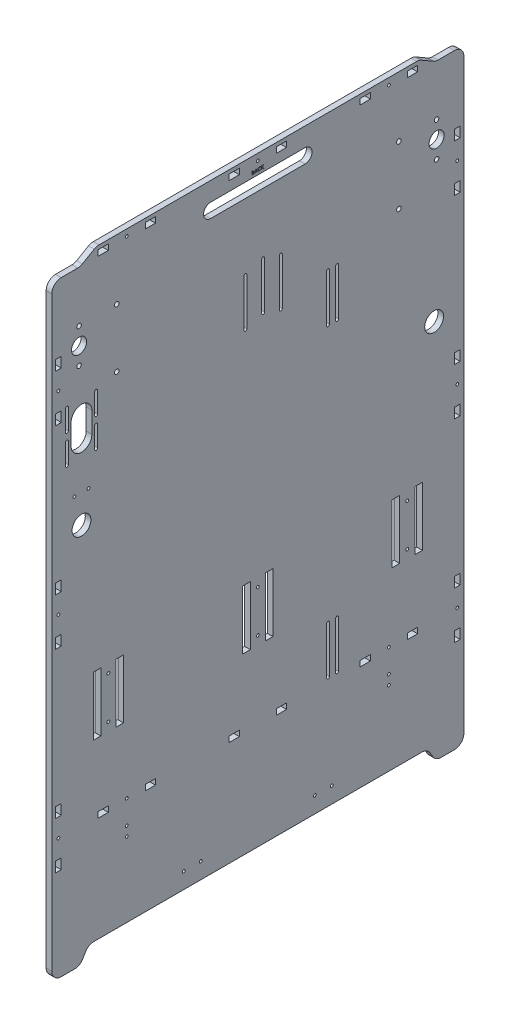
from build123d import *
from build123d.topology import SkipClean

# Parameters (mm, degrees)
SKETCH1_R             = 1.5
SKETCH1_W             = 10.8
SKETCH1_H             = 6
SKETCH1_H_2           = 7
SKETCH1_W_2           = 6
SKETCH1_H_3           = 10.8
BOSS_EXTRUDE1_DEPTH   = 6
SKETCH2_R             = 8
SKETCH2_R_2           = 2.425
CUT_EXTRUDE1_DEPTH    = 688.648458516
FILLET2_R             = 10
FILLET2_OF_MIRROR1_R  = 10
CUT_EXTRUDE2_DEPTH    = 688.648458516
SKETCH4_R             = 2.425
SKETCH4_R_2           = 1.5
SKETCH4_W             = 8
SKETCH4_H             = 62.5
CUT_EXTRUDE3_DEPTH    = 688.648458516
SKETCH5_R             = 1.5
CUT_EXTRUDE6_DEPTH    = 688.648458516
DELETEFACE2_START     = -169.366666667
DELETEFACE2_OUTLINE_W = 6
DELETEFACE2_OUTLINE_H = 7
DELETEFACE2_DEPTH     = 338.733333334
SKETCH7_R             = 1.5
CUT_EXTRUDE7_DEPTH    = 688.648458516
DELETEFACE3_OUTLINE_R = 1.5
DELETEFACE3_DEPTH     = 6
CUT_EXTRUDE8_DEPTH    = 688.648458516
SKETCH9_R             = 10
CUT_EXTRUDE9_DEPTH    = 688.648458516
SKETCH10_R            = 1.5
CUT_EXTRUDE10_DEPTH   = 688.648458516
CUT_EXTRUDE11_DEPTH   = 688.648458516
CUT_EXTRUDE12_DEPTH   = 0.5


# Read off the part's stored shape, not the designer's step: DeleteFace2, DeleteFace3
with BuildPart() as part:
    # Sketch1 → Boss-Extrude1 (new body)
    with BuildSketch(Plane(origin=(0, 0, 0), x_dir=(0, 0, -1), z_dir=(1, 0, 0))):
        with BuildLine():
            Line((0, 652), (-171.129491924, 652))
            Line((-171.129491924, 652), (-188.45, 642))
            Line((-188.45, 642), (-218.45, 642))
            Line((-218.45, 642), (-218.45, 0))
            Line((-218.45, 0), (-188.45, 0))
            Line((-188.45, 0), (-179.789745962, 15))
            Line((-179.789745962, 15), (0, 15))
            Line((0, 15), (0, 127.5))
            ThreePointArc((0, 127.5), (-1.5, 129), (0, 130.5))
            Line((0, 130.5), (0, 643.5))
            ThreePointArc((0, 643.5), (-1.5, 645), (0, 646.5))
            Line((0, 646.5), (0, 652))
        make_face()
        with Locations((-211.45, 539.333333333)):
            Circle(SKETCH1_R, mode=Mode.SUBTRACT)
        with Locations((-211.45, 334)):
            Circle(SKETCH1_R, mode=Mode.SUBTRACT)
        with Locations((-211.45, 128.666666667)):
            Circle(SKETCH1_R, mode=Mode.SUBTRACT)
        with Locations((-138.966666667, 129)):
            Circle(SKETCH1_R, mode=Mode.SUBTRACT)
        with Locations((-138.966666667, 645)):
            Circle(SKETCH1_R, mode=Mode.SUBTRACT)
        with Locations((-113.966666667, 645)):
            Rectangle(SKETCH1_W, SKETCH1_H, mode=Mode.SUBTRACT)
        with Locations((-113.966666667, 129)):
            Rectangle(SKETCH1_W, SKETCH1_H, mode=Mode.SUBTRACT)
        with Locations((-113.966666667, 22.5)):
            Rectangle(SKETCH1_W, SKETCH1_H_2, mode=Mode.SUBTRACT)
        with Locations((-211.45, 564.333333333)):
            Rectangle(SKETCH1_W_2, SKETCH1_H_3, mode=Mode.SUBTRACT)
        with Locations((-211.45, 514.333333333)):
            Rectangle(SKETCH1_W_2, SKETCH1_H_3, mode=Mode.SUBTRACT)
        with Locations((-211.45, 359)):
            Rectangle(SKETCH1_W_2, SKETCH1_H_3, mode=Mode.SUBTRACT)
        with Locations((-211.45, 309)):
            Rectangle(SKETCH1_W_2, SKETCH1_H_3, mode=Mode.SUBTRACT)
        with Locations((-211.45, 153.666666667)):
            Rectangle(SKETCH1_W_2, SKETCH1_H_3, mode=Mode.SUBTRACT)
        with Locations((-211.45, 103.666666667)):
            Rectangle(SKETCH1_W_2, SKETCH1_H_3, mode=Mode.SUBTRACT)
        with Locations((-163.966666667, 129)):
            Rectangle(SKETCH1_W, SKETCH1_H, mode=Mode.SUBTRACT)
        with Locations((-25, 645)):
            Rectangle(SKETCH1_W, SKETCH1_H, mode=Mode.SUBTRACT)
        with Locations((-25, 129)):
            Rectangle(SKETCH1_W, SKETCH1_H, mode=Mode.SUBTRACT)
        with Locations((-163.966666667, 22.5)):
            Rectangle(SKETCH1_W, SKETCH1_H_2, mode=Mode.SUBTRACT)
        with Locations((-25, 22.5)):
            Rectangle(SKETCH1_W, SKETCH1_H_2, mode=Mode.SUBTRACT)
        with Locations((-163.966666667, 645)):
            Rectangle(SKETCH1_W, SKETCH1_H, mode=Mode.SUBTRACT)
    boss_extrude1 = extrude(amount=BOSS_EXTRUDE1_DEPTH)

    # Sketch2 → Cut-Extrude1 (cut, through all)
    with BuildSketch(Plane(origin=(6, 0, 0), x_dir=(0, 0, -1), z_dir=(1, 0, 0))):
        with Locations((-189.55, 569.8)):
            Circle(SKETCH2_R)
        with Locations((-189.55, 588.05)):
            Circle(SKETCH2_R_2)
        with Locations((-189.55, 551.55)):
            Circle(SKETCH2_R_2)
    cut_extrude1 = extrude(amount=-CUT_EXTRUDE1_DEPTH, mode=Mode.SUBTRACT)

    # Fillet2
    fillet2_edges = [part.edges().sort_by_distance(p)[0] for p in [
        (3, 15, 179.789745962),
        (3, 0, 188.45),
        (3, 0, 218.45),
        (3, 642, 218.45),
        (3, 642, 188.45),
        (3, 652, 171.129491924),
    ]]
    fillet(fillet2_edges, radius=FILLET2_R)

    # Mirror1: Boss-Extrude1, Cut-Extrude1 across plane
    with SkipClean():  # the faces are left unmerged after this step: merging them gives an invalid solid
        add(boss_extrude1.mirror(Plane(origin=(6, 130.5, 0), x_dir=(1, 0, 0), z_dir=(0, 0, 1))))
        add(cut_extrude1.mirror(Plane(origin=(6, 130.5, 0), x_dir=(1, 0, 0), z_dir=(0, 0, 1))), mode=Mode.SUBTRACT)

    # Fillet2 of Mirror1
    fillet2_of_mirror1_edges = [part.edges().sort_by_distance(p)[0] for p in [
        (3, 15, -179.789745962),
        (3, 0, -188.45),
        (3, 0, -218.45),
        (3, 642, -218.45),
        (3, 642, -188.45),
        (3, 652, -171.129491924),
    ]]
    fillet(fillet2_of_mirror1_edges, radius=FILLET2_OF_MIRROR1_R)

    # Sketch3 → Cut-Extrude2 (cut, through all)
    with BuildSketch(Plane(origin=(6, 0, 0), x_dir=(0, 0, -1), z_dir=(1, 0, 0))):
        with BuildLine():
            Line((-50, 632), (50, 632))
            ThreePointArc((50, 632), (57.5, 624.5), (50, 617))
            Line((50, 617), (-50, 617))
            ThreePointArc((-50, 617), (-57.5, 624.5), (-50, 632))
        make_face()
    extrude(amount=-CUT_EXTRUDE2_DEPTH, mode=Mode.SUBTRACT)

    # Sketch4 → Cut-Extrude3 (cut, through all)
    with BuildSketch(Plane(origin=(6, 0, 0), x_dir=(0, 0, -1), z_dir=(1, 0, 0))):
        with Locations((-149.55, 588.05)):
            Circle(SKETCH4_R)
        with Locations((-149.55, 526.05)):
            Circle(SKETCH4_R)
        with Locations((-158.45, 253.583333333)):
            Circle(SKETCH4_R_2)
        with Locations((-158.45, 209.083333333)):
            Circle(SKETCH4_R_2)
        with Locations((0, 253.583333333)):
            Circle(SKETCH4_R_2)
        with Locations((0, 209.083333333)):
            Circle(SKETCH4_R_2)
        with Locations((-170.45, 231.333333333)):
            Rectangle(SKETCH4_W, SKETCH4_H)
        with Locations((-146.45, 231.333333333)):
            Rectangle(SKETCH4_W, SKETCH4_H)
        with Locations((-12, 231.333333333)):
            Rectangle(SKETCH4_W, SKETCH4_H)
        with Locations((12, 231.333333333)):
            Rectangle(SKETCH4_W, SKETCH4_H)
    cut_extrude3 = extrude(amount=-CUT_EXTRUDE3_DEPTH, mode=Mode.SUBTRACT)

    # Mirror2: Cut-Extrude3 across plane
    add(cut_extrude3.mirror(Plane.XY), mode=Mode.SUBTRACT)

    # Sketch5 → Cut-Extrude6 (cut, through all)
    with BuildSketch(Plane(origin=(6, 0, 0), x_dir=(0, 0, -1), z_dir=(1, 0, 0))):
        with Locations((-78.483333333, 32)):
            Circle(SKETCH5_R)
        with Locations((-60.483333333, 32)):
            Circle(SKETCH5_R)
    cut_extrude6 = extrude(amount=-CUT_EXTRUDE6_DEPTH, mode=Mode.SUBTRACT)

    # Mirror3: Cut-Extrude6 across plane
    add(cut_extrude6.mirror(Plane.XY), mode=Mode.SUBTRACT)

    # DeleteFace2 outline → DeleteFace2 (add)
    with BuildSketch(Plane.XY.offset(DELETEFACE2_START)):
        with Locations((3, 22.5)):
            Rectangle(DELETEFACE2_OUTLINE_W, DELETEFACE2_OUTLINE_H)
    extrude(amount=DELETEFACE2_DEPTH)

    # Sketch7 → Cut-Extrude7 (cut, through all)
    with BuildSketch(Plane(origin=(6, 0, 0), x_dir=(0, 0, -1), z_dir=(1, 0, 0))):
        with Locations((-194.45, 433.843908623)):
            Circle(SKETCH7_R)
        with Locations((-179.45, 433.843908623)):
            Circle(SKETCH7_R)
        with BuildLine():
            Line((-200.95, 519.343908623), (-200.95, 497.343908623))
            ThreePointArc((-200.95, 497.343908623), (-202.45, 495.843908623), (-203.95, 497.343908623))
            Line((-203.95, 497.343908623), (-203.95, 519.343908623))
            ThreePointArc((-203.95, 519.343908623), (-202.45, 520.843908623), (-200.95, 519.343908623))
        make_face()
        with BuildLine():
            Line((-169.95, 519.343908623), (-169.95, 497.343908623))
            ThreePointArc((-169.95, 497.343908623), (-171.45, 495.843908623), (-172.95, 497.343908623))
            Line((-172.95, 497.343908623), (-172.95, 519.343908623))
            ThreePointArc((-172.95, 519.343908623), (-171.45, 520.843908623), (-169.95, 519.343908623))
        make_face()
        with BuildLine():
            Line((-169.95, 488.343908623), (-169.95, 466.343908623))
            ThreePointArc((-169.95, 466.343908623), (-171.45, 464.843908623), (-172.95, 466.343908623))
            Line((-172.95, 466.343908623), (-172.95, 488.343908623))
            ThreePointArc((-172.95, 488.343908623), (-171.45, 489.843908623), (-169.95, 488.343908623))
        make_face()
        with BuildLine():
            Line((-200.95, 488.343908623), (-200.95, 466.343908623))
            ThreePointArc((-200.95, 466.343908623), (-202.45, 464.843908623), (-203.95, 466.343908623))
            Line((-203.95, 466.343908623), (-203.95, 488.343908623))
            ThreePointArc((-203.95, 488.343908623), (-202.45, 489.843908623), (-200.95, 488.343908623))
        make_face()
        with BuildLine():
            Line((-197.95, 481.843908623), (-197.95, 503.843908623))
            ThreePointArc((-197.95, 503.843908623), (-186.95, 514.843908623), (-175.95, 503.843908623))
            Line((-175.95, 503.843908623), (-175.95, 481.843908623))
            ThreePointArc((-175.95, 481.843908623), (-186.95, 470.843908623), (-197.95, 481.843908623))
        make_face()
    extrude(amount=-CUT_EXTRUDE7_DEPTH, mode=Mode.SUBTRACT)

    # DeleteFace3 outline → DeleteFace3 (add)
    with BuildSketch(Plane.YZ):
        with Locations((129, 0)):
            Circle(DELETEFACE3_OUTLINE_R)
    extrude(amount=DELETEFACE3_DEPTH)

    # Sketch8 → Cut-Extrude8 (cut, through all)
    with BuildSketch(Plane(origin=(6, 0, 0), x_dir=(0, 0, -1), z_dir=(1, 0, 0))):
        with BuildLine():
            Line((72.925, 133.5), (72.925, 183.5))
            ThreePointArc((72.925, 183.5), (74.425, 185), (75.925, 183.5))
            Line((75.925, 183.5), (75.925, 133.5))
            ThreePointArc((75.925, 133.5), (74.425, 132), (72.925, 133.5))
        make_face()
        with BuildLine():
            Line((82.525, 133.5), (82.525, 183.5))
            ThreePointArc((82.525, 183.5), (84.025, 185), (85.525, 183.5))
            Line((85.525, 183.5), (85.525, 133.5))
            ThreePointArc((85.525, 133.5), (84.025, 132), (82.525, 133.5))
        make_face()
        with BuildLine():
            Line((72.925, 457), (72.925, 507))
            ThreePointArc((72.925, 507), (74.425, 508.5), (75.925, 507))
            Line((75.925, 507), (75.925, 457))
            ThreePointArc((75.925, 457), (74.425, 455.5), (72.925, 457))
        make_face()
        with BuildLine():
            Line((82.525, 457), (82.525, 507))
            ThreePointArc((82.525, 507), (84.025, 508.5), (85.525, 507))
            Line((85.525, 507), (85.525, 457))
            ThreePointArc((85.525, 457), (84.025, 455.5), (82.525, 457))
        make_face()
    extrude(amount=-CUT_EXTRUDE8_DEPTH, mode=Mode.SUBTRACT)

    # Sketch9 → Cut-Extrude9 (cut, through all)
    with BuildSketch(Plane(origin=(6, 0, 0), x_dir=(0, 0, -1), z_dir=(1, 0, 0))):
        with Locations((-186.95, 403.843908623)):
            Circle(SKETCH9_R)
    cut_extrude9 = extrude(amount=-CUT_EXTRUDE9_DEPTH, mode=Mode.SUBTRACT)

    # Mirror4: Cut-Extrude9 across plane
    add(cut_extrude9.mirror(Plane.XY), mode=Mode.SUBTRACT)

    # Sketch10 → Cut-Extrude10 (cut, through all)
    with BuildSketch(Plane(origin=(6, 0, 0), x_dir=(0, 0, -1), z_dir=(1, 0, 0))):
        with Locations((-138.966666667, 94)):
            Circle(SKETCH10_R)
        with Locations((-138.966666667, 104)):
            Circle(SKETCH10_R)
    cut_extrude10 = extrude(amount=-CUT_EXTRUDE10_DEPTH, mode=Mode.SUBTRACT)

    # Mirror5: Cut-Extrude10 across plane
    add(cut_extrude10.mirror(Plane.XY), mode=Mode.SUBTRACT)

    # Sketch11 → Cut-Extrude11 (cut, through all)
    with BuildSketch(Plane(origin=(6, 0, 0), x_dir=(0, 0, -1), z_dir=(1, 0, 0))):
        with BuildLine():
            Line((4.15, 502.5), (4.15, 552.5))
            ThreePointArc((4.15, 552.5), (5.65, 554), (7.15, 552.5))
            Line((7.15, 552.5), (7.15, 502.5))
            ThreePointArc((7.15, 502.5), (5.65, 501), (4.15, 502.5))
        make_face()
        with BuildLine():
            Line((25.9, 546.5), (25.9, 496.5))
            ThreePointArc((25.9, 496.5), (24.4, 495), (22.9, 496.5))
            Line((22.9, 496.5), (22.9, 546.5))
            ThreePointArc((22.9, 546.5), (24.4, 548), (25.9, 546.5))
        make_face()
        with BuildLine():
            Line((-11.6, 546.5), (-11.6, 496.5))
            ThreePointArc((-11.6, 496.5), (-13.1, 495), (-14.6, 496.5))
            Line((-14.6, 496.5), (-14.6, 546.5))
            ThreePointArc((-14.6, 546.5), (-13.1, 548), (-11.6, 546.5))
        make_face()
    extrude(amount=-CUT_EXTRUDE11_DEPTH, mode=Mode.SUBTRACT)

    # Sketch12 → Cut-Extrude12 (cut)
    # profile 1 of 4: a face of its own
    with BuildSketch(Plane(origin=(6, 0, 0), x_dir=(0, 0, -1), z_dir=(1, 0, 0))):
        with BuildLine():
            Line((-6.237179487, 635), (-6.237179487, 638.5))
            Line((-6.237179487, 638.5), (-5.676282051, 638.5))
            add(Edge.make_bspline(
                [(-5.676282051, 638.5), (-5.637015724, 638.500004481), (-5.561036124, 638.500013152), (-5.451417391, 638.496163702), (-5.349755273, 638.491184008), (-5.2563733, 638.485612887), (-5.171112527, 638.476012733), (-5.09410261, 638.46589522), (-5.02518968, 638.453694122), (-4.98258456, 638.442749359), (-4.962540064, 638.43760016)],
                knots=[0, 0, 0, 0, 1.311965854, 2.538629056, 3.664479157, 4.713267157, 5.663616078, 6.530575999, 7.308677837, 8, 8, 8, 8], degree=3))
            add(Edge.make_bspline(
                [(-4.962540064, 638.43760016), (-4.936219606, 638.430337123), (-4.884570417, 638.416084712), (-4.810592296, 638.387301353), (-4.740413728, 638.355306608), (-4.674120401, 638.318806588), (-4.612119381, 638.277360636), (-4.554646294, 638.230639824), (-4.500461587, 638.180519523), (-4.451489235, 638.125602894), (-4.407226297, 638.067573304), (-4.368769741, 638.006445956), (-4.335355922, 637.943155529), (-4.308616115, 637.876905554), (-4.288468172, 637.80800113), (-4.273732052, 637.73673649), (-4.26418105, 637.662886135), (-4.263278605, 637.612643325), (-4.262820513, 637.587139423)],
                knots=[0, 0, 0, 0, 1.099996261, 2.158545794, 3.195537121, 4.207578794, 5.205712374, 6.197378256, 7.190519799, 8.17788031, 9.159561366, 10.129234751, 11.085776129, 12.040971148, 13.00380137, 13.975669004, 14.972423361, 16, 16, 16, 16], degree=3))
            add(Edge.make_bspline(
                [(-4.262820513, 637.587139423), (-4.264018289, 637.554373604), (-4.266375963, 637.489878115), (-4.281436947, 637.395145911), (-4.309678639, 637.305610361), (-4.346632206, 637.219621361), (-4.396877504, 637.137499648), (-4.460679315, 637.059284271), (-4.537004258, 636.982566859), (-4.595549703, 636.936579946), (-4.626001603, 636.912660256)],
                knots=[0, 0, 0, 0, 0.986156485, 1.941127874, 2.875419072, 3.804401753, 4.751181392, 5.761612777, 6.835722519, 8, 8, 8, 8], degree=3))
            add(Edge.make_bspline(
                [(-4.626001603, 636.912660256), (-4.601324844, 636.900062985), (-4.552940548, 636.875363221), (-4.484249061, 636.834764183), (-4.420648243, 636.791581957), (-4.361852926, 636.746685387), (-4.30909641, 636.698171241), (-4.26020029, 636.648834973), (-4.217576845, 636.595849818), (-4.179461676, 636.541104269), (-4.146332591, 636.483805604), (-4.117480811, 636.424050586), (-4.093110748, 636.361635081), (-4.072473547, 636.296876733), (-4.057082318, 636.229552802), (-4.047046909, 636.159639212), (-4.039363173, 636.087374403), (-4.03876545, 636.038149419), (-4.038461538, 636.013120994)],
                knots=[0, 0, 0, 0, 1.164658916, 2.283573913, 3.35186032, 4.395461096, 5.390182219, 6.362969632, 7.312859996, 8.245001507, 9.165155236, 10.092416118, 11.032087915, 11.979892451, 12.947605196, 13.931445124, 14.948243989, 16, 16, 16, 16], degree=3))
            add(Edge.make_bspline(
                [(-4.038461538, 636.013120994), (-4.040433723, 635.965318131), (-4.044325821, 635.870979375), (-4.072782942, 635.732468413), (-4.122118547, 635.601147459), (-4.188366091, 635.477538437), (-4.269995812, 635.365219626), (-4.363846583, 635.266829323), (-4.468973541, 635.183544116), (-4.565965865, 635.127333062), (-4.649856588, 635.089610189), (-4.719341706, 635.06628753), (-4.793967251, 635.044681453), (-4.875100181, 635.02950922), (-4.96126967, 635.015621925), (-5.053315873, 635.00704762), (-5.151066759, 635.001237026), (-5.218206293, 635.000420678), (-5.252804487, 635)],
                knots=[0, 0, 0, 0, 1.284142165, 2.534249414, 3.780121997, 5.041676246, 6.291546858, 7.49970053, 8.684500223, 9.883330709, 10.50184324, 11.153274765, 11.851151195, 12.587658647, 13.369265475, 14.195992086, 15.070362669, 16, 16, 16, 16], degree=3))
            Line((-5.252804487, 635), (-6.237179487, 635))
        make_face()
        with BuildLine():
            Line((-5.608974359, 637.871794872), (-5.608974359, 637.108974359))
            Line((-5.608974359, 637.108974359), (-5.442107372, 637.108974359))
            add(Edge.make_bspline(
                [(-5.442107372, 637.108974359), (-5.419428649, 637.109172126), (-5.375648747, 637.109553903), (-5.312413323, 637.114471063), (-5.25361459, 637.122860042), (-5.199475561, 637.134564777), (-5.149491909, 637.149428086), (-5.103982945, 637.167311846), (-5.063148764, 637.189131978), (-5.01570889, 637.221634027), (-4.965561522, 637.269462248), (-4.921417359, 637.338560023), (-4.895416741, 637.4180222), (-4.892520973, 637.474065081), (-4.891025641, 637.503004808)],
                knots=[0, 0, 0, 0, 1.065314748, 2.056525647, 2.977365736, 3.853934255, 4.656397591, 5.425096493, 6.14721249, 6.826394842, 8.123232004, 9.372140726, 10.643011755, 12, 12, 12, 12], degree=3))
            add(Edge.make_bspline(
                [(-4.891025641, 637.503004808), (-4.892222181, 637.53011167), (-4.894535642, 637.5825217), (-4.920714921, 637.656110049), (-4.961376517, 637.721324387), (-5.009383246, 637.765958269), (-5.05459091, 637.796441894), (-5.093300486, 637.816514062), (-5.135787153, 637.834482463), (-5.182873406, 637.84822154), (-5.234290358, 637.858530859), (-5.289788247, 637.86610182), (-5.349462827, 637.871254938), (-5.390680186, 637.871611033), (-5.411959135, 637.871794872)],
                knots=[0, 0, 0, 0, 1.347982417, 2.606269829, 3.849316587, 5.153353503, 5.842674298, 6.568177932, 7.326619318, 8.142485038, 9.012069166, 9.942760135, 10.937925643, 12, 12, 12, 12], degree=3))
            Line((-5.411959135, 637.871794872), (-5.608974359, 637.871794872))
        make_face(mode=Mode.SUBTRACT)
        with BuildLine():
            Line((-5.608974359, 636.525641026), (-5.608974359, 635.628205128))
            Line((-5.608974359, 635.628205128), (-5.428084936, 635.628205128))
            add(Edge.make_bspline(
                [(-5.428084936, 635.628205128), (-5.392322867, 635.628409436), (-5.323565826, 635.628802242), (-5.225071487, 635.633548278), (-5.135515509, 635.642102171), (-5.055135182, 635.652781017), (-4.983807389, 635.667249184), (-4.921773233, 635.685643603), (-4.868181997, 635.705880669), (-4.823355018, 635.730875847), (-4.786733943, 635.759964037), (-4.753687263, 635.789692865), (-4.726743059, 635.823987877), (-4.705424302, 635.861376883), (-4.686972956, 635.900931114), (-4.675844407, 635.944195147), (-4.66737152, 635.98988674), (-4.666905234, 636.021490627), (-4.666666667, 636.037660256)],
                knots=[0, 0, 0, 0, 1.753078804, 3.370512758, 4.83203934, 6.162291463, 7.344201807, 8.395507345, 9.331626367, 10.147333109, 10.898971645, 11.62040215, 12.321813352, 13.025280112, 13.727906689, 14.453419512, 15.208716525, 16, 16, 16, 16], degree=3))
            add(Edge.make_bspline(
                [(-4.666666667, 636.037660256), (-4.667192777, 636.056150482), (-4.668217498, 636.092164468), (-4.676586408, 636.144802751), (-4.691795451, 636.193944081), (-4.710951984, 636.240845068), (-4.737609316, 636.283826493), (-4.769290644, 636.32437578), (-4.807569777, 636.361119805), (-4.850616894, 636.396280985), (-4.900827095, 636.427066502), (-4.958223936, 636.453778392), (-5.023119229, 636.476087179), (-5.095713992, 636.493849449), (-5.175689977, 636.508924042), (-5.263630921, 636.517925239), (-5.358804419, 636.524619824), (-5.424799272, 636.52529289), (-5.458934295, 636.525641026)],
                knots=[0, 0, 0, 0, 0.845221588, 1.646264278, 2.427170338, 3.19324141, 3.95557735, 4.731569926, 5.540061037, 6.376114724, 7.268642756, 8.224665384, 9.265483498, 10.400594375, 11.639216012, 12.983232105, 14.439614077, 16, 16, 16, 16], degree=3))
            Line((-5.458934295, 636.525641026), (-5.608974359, 636.525641026))
        make_face(mode=Mode.SUBTRACT)
    # profile 2 of 4: a face of its own
    with BuildSketch(Plane(origin=(6, 0, 0), x_dir=(0, 0, -1), z_dir=(1, 0, 0))):
        Polygon((-2.332632212, 638.5), (-1.75, 638.5), (-0.336538462, 635), (-1.007512019, 635), (-1.279547276, 635.717948718), (-2.804487179, 635.717948718), (-3.076522436, 635), (-3.746794872, 635), align=None)
        Polygon((-2.041666667, 637.561197917), (-2.566105769, 636.346153846), (-1.517227564, 636.346153846), align=None, mode=Mode.SUBTRACT)
    # profile 3 of 4: a face of its own
    with BuildSketch(Plane(origin=(6, 0, 0), x_dir=(0, 0, -1), z_dir=(1, 0, 0))):
        with BuildLine():
            Line((3.320512821, 637.892828526), (2.859875801, 637.452524038))
            add(Edge.make_bspline(
                [(2.859875801, 637.452524038), (2.820800817, 637.492927638), (2.74447513, 637.571848526), (2.621485725, 637.676332827), (2.493581222, 637.763406355), (2.363249747, 637.836739125), (2.228147016, 637.892220593), (2.089835184, 637.932650872), (1.947431089, 637.957299686), (1.851057474, 637.960119946), (1.802584135, 637.961538462)],
                knots=[0, 0, 0, 0, 1.115251505, 2.178435587, 3.19620269, 4.182487026, 5.141301733, 6.088180966, 7.038406374, 8, 8, 8, 8], degree=3))
            add(Edge.make_bspline(
                [(1.802584135, 637.961538462), (1.762103005, 637.960417785), (1.682217957, 637.958206253), (1.564925772, 637.941993543), (1.452729735, 637.914423124), (1.345245782, 637.876425979), (1.242790188, 637.82725969), (1.145148144, 637.766962311), (1.05256038, 637.696078413), (0.966249928, 637.614974752), (0.88729616, 637.526362907), (0.817535478, 637.431814281), (0.759099717, 637.331545478), (0.711142439, 637.226571947), (0.673785573, 637.116407818), (0.647108077, 637.00112726), (0.631678526, 636.88059298), (0.629375562, 636.798654675), (0.628205128, 636.757011218)],
                knots=[0, 0, 0, 0, 1.035432265, 2.043311493, 3.022114605, 3.98653278, 4.95457646, 5.923598177, 6.917315552, 7.932509744, 8.948865224, 9.949768934, 10.933144597, 11.912367597, 12.897413939, 13.903909035, 14.934704909, 16, 16, 16, 16], degree=3))
            add(Edge.make_bspline(
                [(0.628205128, 636.757011218), (0.628542434, 636.727782926), (0.62920727, 636.670173362), (0.636485082, 636.584952828), (0.648204074, 636.502268764), (0.665164359, 636.422246412), (0.686373363, 636.344816425), (0.711256353, 636.26931082), (0.742471699, 636.196772912), (0.777121203, 636.126360221), (0.817418178, 636.059994047), (0.86086575, 635.996708391), (0.907977548, 635.936813475), (0.959058719, 635.88055415), (1.014828166, 635.828809624), (1.073844455, 635.780023877), (1.137103109, 635.735418182), (1.203290087, 635.69387311), (1.272977159, 635.657782552), (1.344273554, 635.625091479), (1.418260268, 635.598541467), (1.49403647, 635.577139735), (1.571331362, 635.558940759), (1.650900959, 635.54773509), (1.732055493, 635.539249168), (1.786902336, 635.538725212), (1.814503205, 635.538461538)],
                knots=[0, 0, 0, 0, 1.103660481, 2.175337485, 3.227646561, 4.255952547, 5.262355991, 6.258840057, 7.255597736, 8.242457506, 9.22035537, 10.185017736, 11.140346927, 12.096287581, 13.051739095, 14.01125915, 14.986044842, 15.97314143, 16.960198552, 17.947847494, 18.933482797, 19.925264591, 20.920966487, 21.929612487, 22.958107872, 24, 24, 24, 24], degree=3))
            add(Edge.make_bspline(
                [(1.814503205, 635.538461538), (1.861319022, 635.5398157), (1.953299928, 635.542476276), (2.088295134, 635.563281603), (2.216932116, 635.597505189), (2.31971245, 635.637921255), (2.400238126, 635.677832645), (2.461541133, 635.714748715), (2.52493322, 635.756043392), (2.589361499, 635.803275183), (2.65555066, 635.855877287), (2.722332312, 635.915001788), (2.791416077, 635.978701801), (2.836672166, 636.024165752), (2.859875801, 636.047475962)],
                knots=[0, 0, 0, 0, 1.404581149, 2.759636711, 4.088442092, 5.392261763, 6.066678138, 6.783632037, 7.538459478, 8.336747902, 9.180226004, 10.074962426, 11.012997595, 12, 12, 12, 12], degree=3))
            Line((2.859875801, 636.047475962), (3.306490385, 635.578425481))
            add(Edge.make_bspline(
                [(3.306490385, 635.578425481), (3.275095783, 635.548114979), (3.213820236, 635.488955361), (3.121387773, 635.404954225), (3.02907164, 635.329469865), (2.939102003, 635.259762532), (2.850005064, 635.197862968), (2.761790273, 635.143709355), (2.675456259, 635.095932068), (2.58921027, 635.055336849), (2.502515637, 635.020867291), (2.413317048, 634.991191265), (2.321341814, 634.966086414), (2.226028193, 634.945830096), (2.128265211, 634.929587264), (2.027137937, 634.918623446), (1.923287569, 634.911252837), (1.852844255, 634.910590526), (1.817307692, 634.91025641)],
                knots=[0, 0, 0, 0, 1.244526981, 2.429050516, 3.560637417, 4.644440555, 5.67424972, 6.652764056, 7.595344123, 8.486817594, 9.369275933, 10.254498637, 11.166417451, 12.086725134, 13.032340136, 13.991389299, 14.986715468, 16, 16, 16, 16], degree=3))
            add(Edge.make_bspline(
                [(1.817307692, 634.91025641), (1.752031428, 634.911920432), (1.624303924, 634.915176461), (1.437122598, 634.93930143), (1.259305362, 634.979746515), (1.090419621, 635.036947022), (0.930519077, 635.110017988), (0.779644637, 635.199599561), (0.638039477, 635.305453737), (0.506847487, 635.426339803), (0.38817809, 635.559848314), (0.283288085, 635.703199828), (0.196523068, 635.857098866), (0.124480206, 636.019271846), (0.068143635, 636.190458828), (0.02849224, 636.370844982), (0.004039513, 636.560256136), (0.00136435, 636.689628321), (0, 636.755608974)],
                knots=[0, 0, 0, 0, 1.078019885, 2.10938526, 3.111377082, 4.085535484, 5.04941344, 6.010039228, 6.978205633, 7.964457913, 8.951525778, 9.924444315, 10.892603023, 11.863865945, 12.85144698, 13.863884204, 14.910567087, 16, 16, 16, 16], degree=3))
            add(Edge.make_bspline(
                [(0, 636.755608974), (0.000576508, 636.798640994), (0.001719007, 636.883919938), (0.013726774, 637.009542733), (0.0304663, 637.132002487), (0.057022036, 637.250027663), (0.089032356, 637.365208277), (0.128841395, 637.476292451), (0.176385573, 637.583599451), (0.230132427, 637.687308917), (0.290935706, 637.78674144), (0.358859643, 637.881042737), (0.432155612, 637.970940799), (0.512584795, 638.055242959), (0.598978451, 638.134689407), (0.691726637, 638.208849608), (0.79027152, 638.278787103), (0.894879823, 638.342698373), (1.003519286, 638.400509514), (1.11481968, 638.451501409), (1.228507552, 638.494118891), (1.34410222, 638.529468521), (1.46209207, 638.555854519), (1.58163492, 638.575827869), (1.703747936, 638.586993099), (1.785736248, 638.588820919), (1.827123397, 638.58974359)],
                knots=[0, 0, 0, 0, 1.071919942, 2.124283339, 3.142214191, 4.149696895, 5.136002878, 6.119640489, 7.086990633, 8.058538607, 9.028339693, 9.988281803, 10.952401235, 11.916291999, 12.888973767, 13.874849856, 14.873389453, 15.898127285, 16.927174885, 17.938320013, 18.946391617, 19.950418109, 20.947802303, 21.956882652, 22.968648068, 24, 24, 24, 24], degree=3))
            add(Edge.make_bspline(
                [(1.827123397, 638.58974359), (1.86243088, 638.589214692), (1.932678745, 638.588162395), (2.037289604, 638.579390354), (2.141063834, 638.565613953), (2.243629892, 638.544828298), (2.345721435, 638.520153099), (2.445996866, 638.487844329), (2.546038084, 638.451830117), (2.64427609, 638.408782479), (2.740848012, 638.361792095), (2.833491499, 638.308479797), (2.923762027, 638.252126365), (3.009659255, 638.189396556), (3.092792224, 638.122565697), (3.172726224, 638.051321984), (3.248759786, 637.974477576), (3.296474229, 637.920182466), (3.320512821, 637.892828526)],
                knots=[0, 0, 0, 0, 0.996412454, 1.982464992, 2.961075852, 3.949442424, 4.934965278, 5.923860011, 6.921385422, 7.934793307, 8.949617135, 9.951082467, 10.950285876, 11.951772932, 12.951063433, 13.960125323, 14.972308753, 16, 16, 16, 16], degree=3))
        make_face()
    # profile 4 of 4: a face of its own
    with BuildSketch(Plane(origin=(6, 0, 0), x_dir=(0, 0, -1), z_dir=(1, 0, 0))):
        Polygon((3.948717949, 638.5), (4.576923077, 638.5), (4.576923077, 637.268129006), (5.569711538, 638.5), (6.362680288, 638.5), (5.115384615, 636.951923077), (6.483974359, 635), (5.727463942, 635), (4.576923077, 636.641326122), (4.576923077, 635), (3.948717949, 635), align=None)
    extrude(amount=-CUT_EXTRUDE12_DEPTH, mode=Mode.SUBTRACT)


solid = part.part
